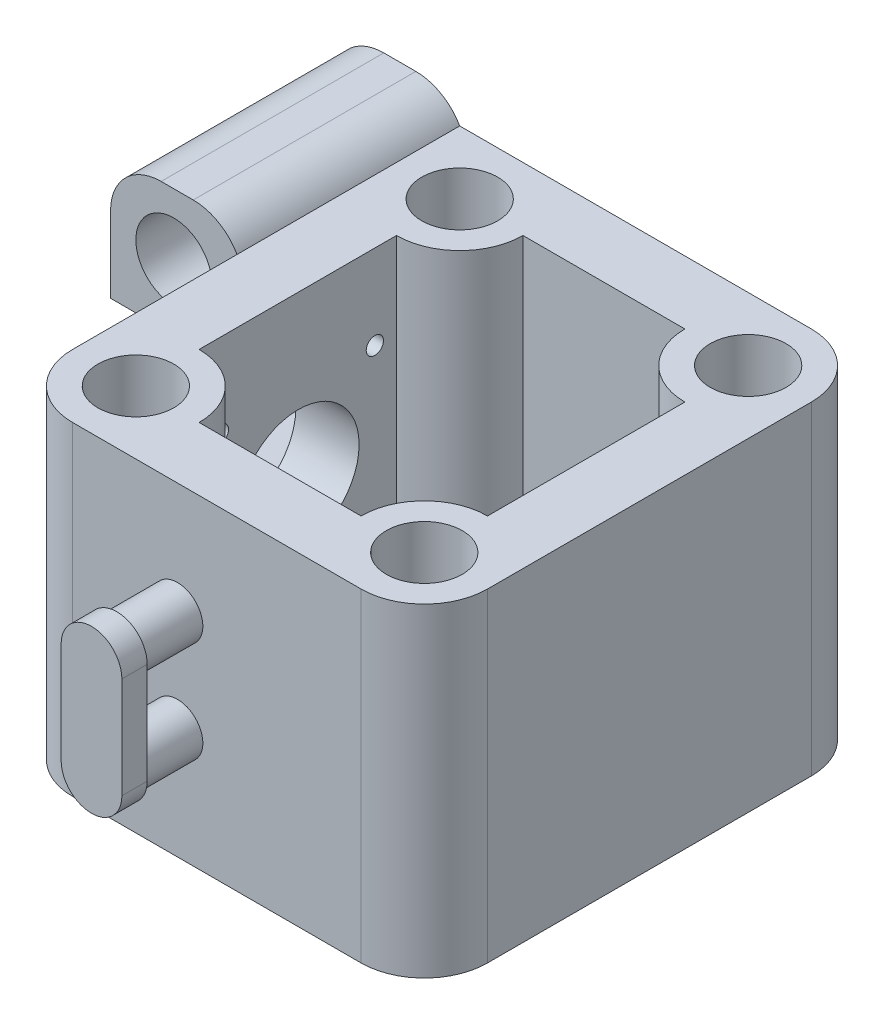
from build123d import *

# Parameters (mm, degrees)
BOSS_EXTRUDE1_DEPTH                                 = 64
CUT_EXTRUDE3_REACH                                  = 106.434
SKETCH3_R                                           = 12
SKETCH4_W                                           = 44
SKETCH4_H                                           = 25
BOSS_EXTRUDE2_DEPTH                                 = 25
SKETCH5_W                                           = 20
SKETCH5_H                                           = 24.0004513
BOSS_EXTRUDE3_DEPTH                                 = 3
CUT_EXTRUDE4_REACH                                  = 107.556
SKETCH6_R                                           = 7.5
FILLET1_R                                           = 10
BOSS_EXTRUDE4_DEPTH                                 = 12
CSK_FOR_M3_COUNTERSUNK_FLAT_HEAD_SCREW1_D           = 3.4
CSK_FOR_M3_COUNTERSUNK_FLAT_HEAD_SCREW1_DEPTH       = 30
CSK_FOR_M3_COUNTERSUNK_FLAT_HEAD_SCREW1_CSINK_D     = 6.3
CSK_FOR_M3_COUNTERSUNK_FLAT_HEAD_SCREW1_CSINK_ANGLE = 90
CSK_FOR_M3_COUNTERSUNK_FLAT_HEAD_SCREW1_TIP         = 1.021463052
CSK_FOR_M3_COUNTERSUNK_FLAT_HEAD_SCR_2_COUNT        = 2
CSK_FOR_M3_COUNTERSUNK_FLAT_HEAD_SCR_2_PITCH        = 30.615707585
CSK_FOR_M3_COUNTERSUNK_FLAT_HEAD_SCR_3_COUNT        = 2
CSK_FOR_M3_COUNTERSUNK_FLAT_HEAD_SCR_3_PITCH        = 43.296866747
CSK_FOR_M3_COUNTERSUNK_FLAT_HEAD_SCR_4_COUNT        = 2
CSK_FOR_M3_COUNTERSUNK_FLAT_HEAD_SCR_4_PITCH        = 30.838341296
SKETCH19_R                                          = 2.5
CUT_EXTRUDE5_DEPTH                                  = 30
BOSS_EXTRUDE5_DEPTH                                 = 5
FILLET2_R                                           = 10


with BuildPart() as part:
    # Sketch2 → Boss-Extrude1 (new body)
    with BuildSketch(Plane(origin=(0, 0, 0), x_dir=(1, 0, 0), z_dir=(0, 1, 0))):
        with BuildLine():
            ThreePointArc((-28.5, 44.5), (-19.661165235, 40.838834765), (-16, 32))
            Line((-16, 32), (16, 32))
            ThreePointArc((16, 32), (19.661165235, 40.838834765), (28.5, 44.5))
            Line((28.5, 44.5), (-28.5, 44.5))
        make_face()
        with BuildLine():
            Line((-28.5, -19.5), (-28.5, 19.5))
            ThreePointArc((-28.5, 19.5), (-37.338834765, 23.161165235), (-41, 32))
            Line((-41, 32), (-41, -32))
            ThreePointArc((-41, -32), (-37.338834765, -23.161165235), (-28.5, -19.5))
        make_face()
        with BuildLine():
            Line((16, -32), (-16, -32))
            ThreePointArc((-16, -32), (-19.661165235, -40.838834765), (-28.5, -44.5))
            Line((-28.5, -44.5), (28.5, -44.5))
            ThreePointArc((28.5, -44.5), (19.661165235, -40.838834765), (16, -32))
        make_face()
        with BuildLine():
            ThreePointArc((41, 32), (37.338834765, 23.161165235), (28.5, 19.5))
            Line((28.5, 19.5), (28.5, -19.5))
            ThreePointArc((28.5, -19.5), (37.338834765, -23.161165235), (41, -32))
            Line((41, -32), (41, 32))
        make_face()
        with BuildLine():
            ThreePointArc((28.5, 44.5), (19.661165235, 40.838834765), (16, 32))
            Line((16, 32), (21, 32))
            ThreePointArc((21, 32), (28.5, 39.5), (36, 32))
            ThreePointArc((36, 32), (33.803300859, 26.696699141), (28.5, 24.5))
            Line((28.5, 24.5), (28.5, 19.5))
            ThreePointArc((28.5, 19.5), (37.338834765, 23.161165235), (41, 32))
            ThreePointArc((41, 32), (37.338834765, 40.838834765), (28.5, 44.5))
        make_face()
        with BuildLine():
            Line((21, 32), (16, 32))
            ThreePointArc((16, 32), (19.661165235, 23.161165235), (28.5, 19.5))
            Line((28.5, 19.5), (28.5, 24.5))
            ThreePointArc((28.5, 24.5), (23.196699141, 26.696699141), (21, 32))
        make_face()
        with BuildLine():
            ThreePointArc((-28.5, 24.5), (-33.803300859, 37.303300859), (-21, 32))
            Line((-21, 32), (-16, 32))
            ThreePointArc((-16, 32), (-19.661165235, 40.838834765), (-28.5, 44.5))
            ThreePointArc((-28.5, 44.5), (-37.338834765, 40.838834765), (-41, 32))
            ThreePointArc((-41, 32), (-37.338834765, 23.161165235), (-28.5, 19.5))
            Line((-28.5, 19.5), (-28.5, 24.5))
        make_face()
        with BuildLine():
            Line((-16, 32), (-21, 32))
            ThreePointArc((-21, 32), (-23.196699141, 26.696699141), (-28.5, 24.5))
            Line((-28.5, 24.5), (-28.5, 19.5))
            ThreePointArc((-28.5, 19.5), (-19.661165235, 23.161165235), (-16, 32))
        make_face()
        with BuildLine():
            ThreePointArc((-16, -32), (-19.661165235, -23.161165235), (-28.5, -19.5))
            Line((-28.5, -19.5), (-28.5, -24.5))
            ThreePointArc((-28.5, -24.5), (-23.196699141, -26.696699141), (-21, -32))
            Line((-21, -32), (-16, -32))
        make_face()
        with BuildLine():
            Line((-28.5, -24.5), (-28.5, -19.5))
            ThreePointArc((-28.5, -19.5), (-37.338834765, -23.161165235), (-41, -32))
            ThreePointArc((-41, -32), (-37.338834765, -40.838834765), (-28.5, -44.5))
            ThreePointArc((-28.5, -44.5), (-19.661165235, -40.838834765), (-16, -32))
            Line((-16, -32), (-21, -32))
            ThreePointArc((-21, -32), (-33.803300859, -37.303300859), (-28.5, -24.5))
        make_face()
        with BuildLine():
            ThreePointArc((41, -32), (37.338834765, -23.161165235), (28.5, -19.5))
            Line((28.5, -19.5), (28.5, -24.5))
            ThreePointArc((28.5, -24.5), (33.803300859, -26.696699141), (36, -32))
            ThreePointArc((36, -32), (28.5, -39.5), (21, -32))
            Line((21, -32), (16, -32))
            ThreePointArc((16, -32), (19.661165235, -40.838834765), (28.5, -44.5))
            ThreePointArc((28.5, -44.5), (37.338834765, -40.838834765), (41, -32))
        make_face()
        with BuildLine():
            Line((28.5, -24.5), (28.5, -19.5))
            ThreePointArc((28.5, -19.5), (19.661165235, -23.161165235), (16, -32))
            Line((16, -32), (21, -32))
            ThreePointArc((21, -32), (23.196699141, -26.696699141), (28.5, -24.5))
        make_face()
        with BuildLine():
            ThreePointArc((-41, 32), (-37.338834765, 40.838834765), (-28.5, 44.5))
            Line((-28.5, 44.5), (-41, 44.5))
            Line((-41, 44.5), (-41, 32))
        make_face()
    extrude(amount=BOSS_EXTRUDE1_DEPTH)

    # Sketch3 → Cut-Extrude3 (cut, up to next)
    with BuildSketch(Plane(origin=(-28.5, 0, 0), x_dir=(0, 0, -1), z_dir=(1, 0, 0)), mode=Mode.PRIVATE) as cut_extrude3_sk1:
        with Locations((0.116801861, 31.912269885)):
            Circle(SKETCH3_R)
    cut_extrude3_tool1 = extrude(cut_extrude3_sk1.sketch, amount=-CUT_EXTRUDE3_REACH, mode=Mode.PRIVATE) & part.part
    add(cut_extrude3_tool1.solids().sort_by_distance((-28.5, 31.91227, -0.116802))[0], mode=Mode.SUBTRACT)

    # Sketch4 → Boss-Extrude2 (add)
    with BuildSketch(Plane.ZY.offset(41)):
        with Locations((-22.5, 56.5)):
            Rectangle(SKETCH4_W, SKETCH4_H)
        with Locations((-22.5, 7.5)):
            Rectangle(SKETCH4_W, SKETCH4_H)
    extrude(amount=BOSS_EXTRUDE2_DEPTH)

    # Sketch5 → Boss-Extrude3 (add)
    with BuildSketch(Plane.ZY.offset(66)):
        with Locations((-31.877330664, 32)):
            Rectangle(SKETCH5_W, SKETCH5_H)
    extrude(amount=-BOSS_EXTRUDE3_DEPTH)

    # Sketch6 → Cut-Extrude4 (cut, up to next)
    with BuildSketch(Plane.XY.offset(-0.5), mode=Mode.PRIVATE) as cut_extrude4_sk1:
        with Locations((-53.5, 56.5)):
            Circle(SKETCH6_R)
    cut_extrude4_tool1 = extrude(cut_extrude4_sk1.sketch, amount=-CUT_EXTRUDE4_REACH, mode=Mode.PRIVATE) & part.part
    # Sketch6 → Cut-Extrude4 (cut, up to next)
    with BuildSketch(Plane.XY.offset(-0.5), mode=Mode.PRIVATE) as cut_extrude4_sk2:
        with Locations((-53.5, 7.5)):
            Circle(SKETCH6_R)
    cut_extrude4_tool2 = extrude(cut_extrude4_sk2.sketch, amount=-CUT_EXTRUDE4_REACH, mode=Mode.PRIVATE) & part.part
    add(cut_extrude4_tool1.solids().sort_by_distance((-53.5, 56.5, -0.5))[0], mode=Mode.SUBTRACT)
    add(cut_extrude4_tool2.solids().sort_by_distance((-53.5, 7.5, -0.5))[0], mode=Mode.SUBTRACT)

    # Fillet1
    fillet1_edges = [part.edges().sort_by_distance(p)[0] for p in [
        (-66, 69, -22.5),
        (-66, -5, -22.5),
    ]]
    fillet(fillet1_edges, radius=FILLET1_R)

    # Sketch7 → Boss-Extrude4 (add)
    with BuildSketch(Plane.XY.offset(44.5)):
        with BuildLine():
            ThreePointArc((-2.761158477, 41.979444873), (-4.225624571, 45.514978779), (-7.761158477, 46.979444873))
            Line((-7.761158477, 46.979444873), (-7.761158477, 36.979444873))
            ThreePointArc((-7.761158477, 36.979444873), (-4.225624571, 38.443910967), (-2.761158477, 41.979444873))
        make_face()
        with BuildLine():
            Line((-7.761158477, 36.979444873), (-7.761158477, 46.979444873))
            ThreePointArc((-7.761158477, 46.979444873), (-12.761158477, 41.979444873), (-7.761158477, 36.979444873))
        make_face()
        with BuildLine():
            ThreePointArc((-2.761158477, 21.979444873), (-4.225624571, 25.514978779), (-7.761158477, 26.979444873))
            Line((-7.761158477, 26.979444873), (-7.761158477, 16.979444873))
            ThreePointArc((-7.761158477, 16.979444873), (-4.225624571, 18.443910967), (-2.761158477, 21.979444873))
        make_face()
        with BuildLine():
            Line((-7.761158477, 16.979444873), (-7.761158477, 26.979444873))
            ThreePointArc((-7.761158477, 26.979444873), (-12.761158477, 21.979444873), (-7.761158477, 16.979444873))
        make_face()
    extrude(amount=BOSS_EXTRUDE4_DEPTH)

    # CSK for M3 Countersunk Flat Head Screw1
    with Locations(Plane.ZY.offset(66)):
        with Locations((-32.025975477, 32.05526265)):
            CounterSinkHole(CSK_FOR_M3_COUNTERSUNK_FLAT_HEAD_SCREW1_D / 2, CSK_FOR_M3_COUNTERSUNK_FLAT_HEAD_SCREW1_CSINK_D / 2, depth=CSK_FOR_M3_COUNTERSUNK_FLAT_HEAD_SCREW1_DEPTH, counter_sink_angle=CSK_FOR_M3_COUNTERSUNK_FLAT_HEAD_SCREW1_CSINK_ANGLE)
            with Locations((0, 0, -(CSK_FOR_M3_COUNTERSUNK_FLAT_HEAD_SCREW1_DEPTH + CSK_FOR_M3_COUNTERSUNK_FLAT_HEAD_SCREW1_TIP / 2))):  # 118° drill point
                Cone(0, CSK_FOR_M3_COUNTERSUNK_FLAT_HEAD_SCREW1_D / 2, CSK_FOR_M3_COUNTERSUNK_FLAT_HEAD_SCREW1_TIP, mode=Mode.SUBTRACT)

    # Sketch18 → CSK for M3 Countersunk Flat Head Screw4 (revolve, cut)
    with BuildSketch(Plane(origin=(-41, 47.307754041, -15.226129888), x_dir=(0, 0, 1), z_dir=(0, 1, 0))):
        Polygon((0, 0), (0, 21.021463052), (1.7, 20), (1.7, 1.45), (3.15, 0), align=None)
    csk_for_m3_countersunk_flat_head_screw4 = revolve(axis=Axis((-47.35, 47.307754041, -15.226129888), (1, 0, 0)), mode=Mode.SUBTRACT)

    # CSK for M3 Countersunk Flat Head Scr 2: CSK for M3 Countersunk Flat Head Screw4 ×2
    with Locations(*[Vector(0, 0.003610084778421308, 0.9999934836227148) * (i * CSK_FOR_M3_COUNTERSUNK_FLAT_HEAD_SCR_2_PITCH) for i in range(1, CSK_FOR_M3_COUNTERSUNK_FLAT_HEAD_SCR_2_COUNT)]):
        add(csk_for_m3_countersunk_flat_head_screw4, mode=Mode.SUBTRACT)

    # CSK for M3 Countersunk Flat Head Scr 3: CSK for M3 Countersunk Flat Head Screw4 ×2
    with Locations(*[Vector(0, -0.7071067811865475, 0.7071067811865476) * (i * CSK_FOR_M3_COUNTERSUNK_FLAT_HEAD_SCR_3_PITCH) for i in range(1, CSK_FOR_M3_COUNTERSUNK_FLAT_HEAD_SCR_3_COUNT)]):
        add(csk_for_m3_countersunk_flat_head_screw4, mode=Mode.SUBTRACT)

    # CSK for M3 Countersunk Flat Head Scr 4: CSK for M3 Countersunk Flat Head Screw4 ×2
    with Locations(*[Vector(0, -0.9999421948610748, -0.010752066611409657) * (i * CSK_FOR_M3_COUNTERSUNK_FLAT_HEAD_SCR_4_PITCH) for i in range(1, CSK_FOR_M3_COUNTERSUNK_FLAT_HEAD_SCR_4_COUNT)]):
        add(csk_for_m3_countersunk_flat_head_screw4, mode=Mode.SUBTRACT)

    # Sketch19 → Cut-Extrude5 (cut)
    with BuildSketch(Plane.ZY.offset(66)):
        with Locations((-15.226129888, 47.418279341)):
            Circle(SKETCH19_R)
        with Locations((-15.336655187, 16.25014476)):
            Circle(SKETCH19_R)
    extrude(amount=-CUT_EXTRUDE5_DEPTH, mode=Mode.SUBTRACT)

    # Sketch20 → Boss-Extrude5 (add)
    with BuildSketch(Plane.XY.offset(56.5)):
        with BuildLine():
            Line((-1.761158477, 41.979444873), (-1.761158477, 21.979444873))
            ThreePointArc((-1.761158477, 21.979444873), (-7.761158477, 15.979444873), (-13.761158477, 21.979444873))
            Line((-13.761158477, 21.979444873), (-13.761158477, 41.979444873))
            ThreePointArc((-13.761158477, 41.979444873), (-7.761158477, 47.979444873), (-1.761158477, 41.979444873))
        make_face()
    extrude(amount=BOSS_EXTRUDE5_DEPTH)

    # Fillet2
    # the kernel refuses this fillet: 10 mm, written as the material it takes off along each edge
    with BuildSketch(Plane(origin=(-41, -5, -66.150635095), x_dir=(0, 1, 0), z_dir=(0, 0, 1))) as fillet2_piece_1:
        with BuildLine():
            CenterArc((10, 8.660254038), FILLET2_R, 180, 60)
            Line((0, 8.660254038), (-0.2, 8.660254038))
            Line((-0.2, 8.660254038), (-0.2, 0))
            Line((-0.2, 0), (0, -0.2))
            ThreePointArc((0, -0.2), (2.5, -0.2), (4.9, -0.173205081))
            Line((4.9, -0.173205081), (5, 0))
        make_face()
    extrude(amount=87.301270189, mode=Mode.SUBTRACT)
    with BuildSketch(Plane(origin=(-41, 69, -66.150635095), x_dir=(0, -1, 0), z_dir=(0, 0, 1))) as fillet2_piece_2:
        with BuildLine():
            CenterArc((10, -8.660254038), FILLET2_R, 120, 60)
            Line((0, -8.660254038), (-0.2, -8.660254038))
            Line((-0.2, -8.660254038), (-0.2, 0))
            Line((-0.2, 0), (0, 0.2))
            ThreePointArc((0, 0.2), (2.5, 0.2), (4.9, 0.173205081))
            Line((4.9, 0.173205081), (5, 0))
        make_face()
    extrude(amount=87.301270189, mode=Mode.SUBTRACT)


solid = part.part
